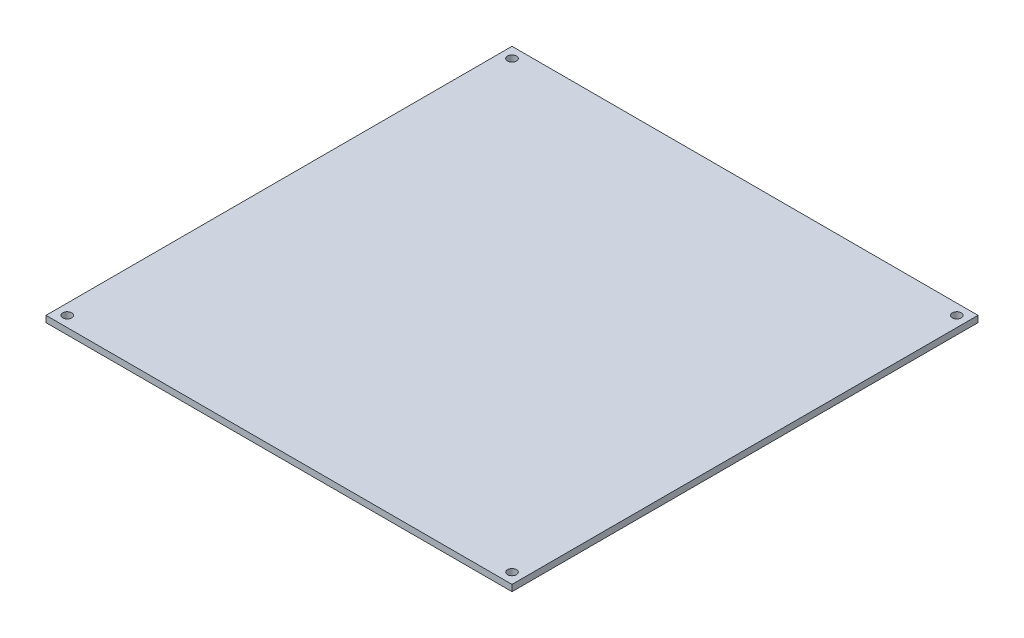
from build123d import *

# Parameters (mm, degrees)
SKETCH1_W           = 220
SKETCH1_H           = 220
SKETCH1_R           = 2.100025747
BOSS_EXTRUDE1_DEPTH = 3


with BuildPart() as part:
    # Sketch1 → Boss-Extrude1 (new body)
    with BuildSketch(Plane(origin=(0, 0, 0), x_dir=(1, 0, 0), z_dir=(0, 1, 0))):
        Rectangle(SKETCH1_W, SKETCH1_H)
        with Locations((-105, 105)):
            Circle(SKETCH1_R, mode=Mode.SUBTRACT)
        with Locations((105, 105)):
            Circle(SKETCH1_R, mode=Mode.SUBTRACT)
        with Locations((105, -105)):
            Circle(SKETCH1_R, mode=Mode.SUBTRACT)
        with Locations((-105, -105)):
            Circle(SKETCH1_R, mode=Mode.SUBTRACT)
    extrude(amount=BOSS_EXTRUDE1_DEPTH)


solid = part.part
